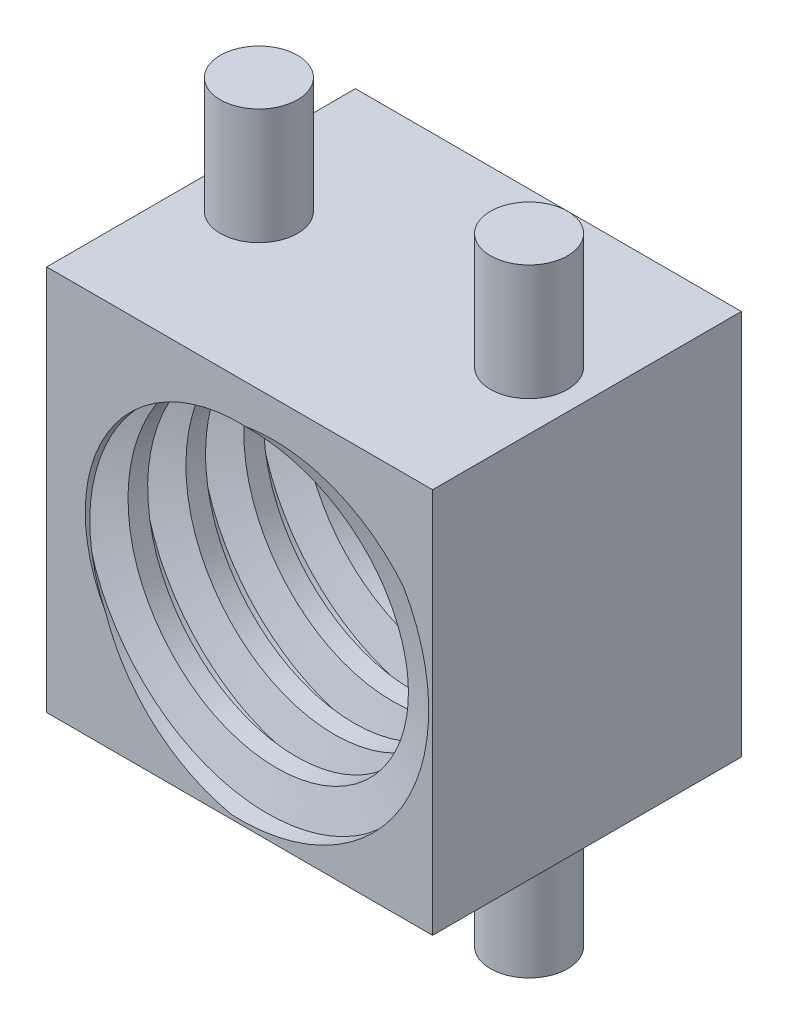
from build123d import *

# Parameters (mm, degrees)
SKETCH_1_W      = 8
SKETCH_1_H      = 1
SWEEP_1_PITCH   = 1.5
EXTRUDE_1_DEPTH = 8
SKETCH_5_R      = 1
EXTRUDE_2_DEPTH = 3


with BuildPart() as part:
    # 草图1 → 旋转1 (revolve)
    with BuildSketch(Plane(origin=(0, 0, 0), x_dir=(0, 0, -1), z_dir=(1, 0, 0)), mode=Mode.PRIVATE) as revolve_1_sk:
        with Locations((-4, 4.5)):
            Rectangle(SKETCH_1_W, SKETCH_1_H)
    revolve(revolve_1_sk.sketch.rotate(Axis((0, 0, 0), (0, 0, 1)), 90), axis=Axis((0, 0, 0), (0, 0, 1)))

    # 切除-扫描1: the profile of 草图2 profile screwed along a right-hand helix of 10.666667 turns, 6 arcs to a turn; built about Z, then put on its axis
    sweep_1_z = Axis((0, 0, 0), (0, 0, 1))
    sweep_1_corners = [(3.9997, 0, 8.0385e-05), (3.9997, 0, -0.991234658), (4.9, 0, -0.75), (4.9, 0, -0.241154273)]
    with BuildLine(mode=Mode.PRIVATE) as sweep_1_profile:
        Line(sweep_1_corners[0], sweep_1_corners[1])
        Line(sweep_1_corners[1], sweep_1_corners[2])
        Line(sweep_1_corners[2], sweep_1_corners[3])
        Line(sweep_1_corners[3], sweep_1_corners[0])
    sweep_1_cap = Face(sweep_1_profile.wire())
    sweep_1_turn_angles = [0, 30, 60, 90, 120, 150, 180, 210, 240, 270, 300, 330, 360]
    sweep_1_turn_weights = [1, 0.8660254037844387, 1, 0.8660254037844387, 1, 0.8660254037844387, 1, 0.8660254037844387, 1, 0.8660254037844387, 1, 0.8660254037844387, 1]
    sweep_1_turn_rails = [Edge.make_bspline([Vector(p[0], p[1], 0).rotate(sweep_1_z, sweep_1_turn_angles[k]) / sweep_1_turn_weights[k] + Vector(0, 0, p[2] + SWEEP_1_PITCH * sweep_1_turn_angles[k] / 360) for k in range(13)], [0, 0, 0, 1, 1, 2, 2, 3, 3, 4, 4, 5, 5, 6, 6, 6], 2, sweep_1_turn_weights) for p in sweep_1_corners]
    sweep_1_turn_sides = [Face.make_surface_from_curves(sweep_1_turn_rails[p[0]], sweep_1_turn_rails[p[1]]) for p in [(0, 1), (1, 2), (2, 3), (3, 0)]]
    sweep_1_last_angles = [3600, 3630, 3660, 3690, 3720, 3750, 3780, 3810, 3840]
    sweep_1_last_weights = [1, 0.8660254037844387, 1, 0.8660254037844387, 1, 0.8660254037844387, 1, 0.8660254037844247, 1]
    sweep_1_last_rails = [Edge.make_bspline([Vector(p[0], p[1], 0).rotate(sweep_1_z, sweep_1_last_angles[k]) / sweep_1_last_weights[k] + Vector(0, 0, p[2] + SWEEP_1_PITCH * sweep_1_last_angles[k] / 360) for k in range(9)], [0, 0, 0, 1, 1, 2, 2, 3, 3, 4, 4, 4], 2, sweep_1_last_weights) for p in sweep_1_corners]
    sweep_1_last_sides = [Face.make_surface_from_curves(sweep_1_last_rails[p[0]], sweep_1_last_rails[p[1]]) for p in [(0, 1), (1, 2), (2, 3), (3, 0)]]
    sweep_1 = Plane(origin=(0, 0, 0), x_dir=(0, 1, 0), z_dir=(0, 0, 1)) * Solid(Shell([*[p.moved(Location((0, 0, SWEEP_1_PITCH * i))) for i in range(10) for p in sweep_1_turn_sides], *sweep_1_last_sides, sweep_1_cap, sweep_1_cap.rotate(sweep_1_z, 3840).moved(Location((0, 0, SWEEP_1_PITCH * 3840 / 360)))]))
    add(sweep_1, mode=Mode.SUBTRACT)

    # 草图4 → 凸台-拉伸1 (add)
    with BuildSketch(Plane.XY):
        with BuildLine():
            ThreePointArc((0, -5), (-3.535533906, -3.535533906), (-5, 0))
            Line((-5, 0), (-5, -5))
            Line((-5, -5), (0, -5))
        make_face()
        with BuildLine():
            Line((0, 5), (-5, 5))
            Line((-5, 5), (-5, 0))
            ThreePointArc((-5, 0), (-3.535533906, 3.535533906), (0, 5))
        make_face()
        with BuildLine():
            Line((5, 5), (0, 5))
            ThreePointArc((0, 5), (3.535533906, 3.535533906), (5, 0))
            Line((5, 0), (5, 5))
        make_face()
        with BuildLine():
            Line((5, -5), (5, 0))
            ThreePointArc((5, 0), (3.535533906, -3.535533906), (0, -5))
            Line((0, -5), (5, -5))
        make_face()
    extrude(amount=EXTRUDE_1_DEPTH)

    # 草图5 → 凸台-拉伸2 (add)
    with BuildSketch(Plane(origin=(0, 5, 0), x_dir=(1, 0, 0), z_dir=(0, 1, 0))):
        with Locations(Location((-3.5, -4, 0), (0, 0, 270))):
            Circle(SKETCH_5_R)
        with Locations(Location((3.5, -4, 0), (0, 0, 270))):
            Circle(SKETCH_5_R)
    extrude_2 = extrude(amount=EXTRUDE_2_DEPTH)

    # 镜向1: 凸台-拉伸2 across plane
    add(extrude_2.mirror(Plane.ZX))


solid = part.part
